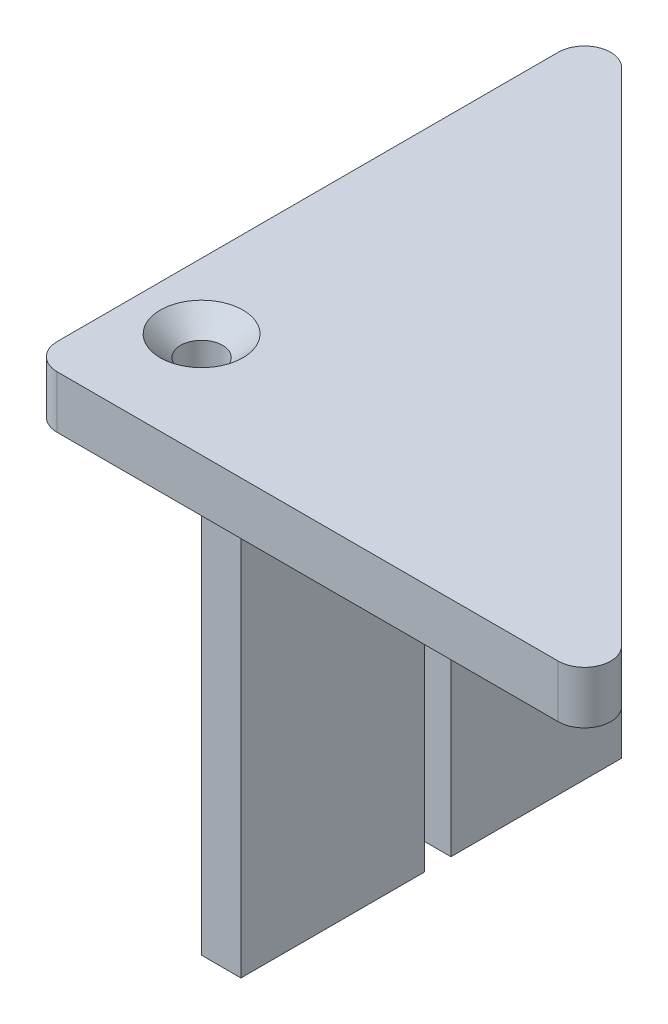
from build123d import *

# Parameters (mm, degrees)
SKETCH1_R                                           = 1.6
BOSS_EXTRUDE1_DEPTH                                 = 4
CSK_FOR_M3_COUNTERSUNK_FLAT_HEAD_SCREW1_D           = 3.2
CSK_FOR_M3_COUNTERSUNK_FLAT_HEAD_SCREW1_CSINK_D     = 6.3
CSK_FOR_M3_COUNTERSUNK_FLAT_HEAD_SCREW1_CSINK_ANGLE = 90
FILLET1_R                                           = 2
SKETCH5_W                                           = 3
SKETCH5_H                                           = 14
SKETCH5_H_2                                         = 13
BOSS_EXTRUDE2_DEPTH                                 = 32


with BuildPart() as part:
    # Sketch1 → Boss-Extrude1 (new body)
    with BuildSketch(Plane(origin=(0, 0, 0), x_dir=(1, 0, 0), z_dir=(0, 1, 0))):
        Polygon((-22.811288741, 22.811288741), (22.188711259, -22.188711259), (-22.811288741, -22.188711259), align=None)
        with Locations((-17.811288741, -14.188711259)):
            Circle(SKETCH1_R, mode=Mode.SUBTRACT)
    extrude(amount=BOSS_EXTRUDE1_DEPTH)

    # CSK for M3 Countersunk Flat Head Screw1 (through all)
    with Locations(Plane(origin=(0, 4, 0), x_dir=(1, 0, 0), z_dir=(0, 1, 0))):
        with Locations((-17.811288741, -14.188711259)):
            CounterSinkHole(CSK_FOR_M3_COUNTERSUNK_FLAT_HEAD_SCREW1_D / 2, CSK_FOR_M3_COUNTERSUNK_FLAT_HEAD_SCREW1_CSINK_D / 2, counter_sink_angle=CSK_FOR_M3_COUNTERSUNK_FLAT_HEAD_SCREW1_CSINK_ANGLE)

    # Fillet1
    fillet1_edges = [part.edges().sort_by_distance(p)[0] for p in [
        (-22.811288741, 2, 22.188711259),
        (22.188711259, 2, 22.188711259),
        (-22.811288741, 2, -22.811288741),
    ]]
    fillet(fillet1_edges, radius=FILLET1_R)

    # Sketch5 → Boss-Extrude2 (add)
    with BuildSketch(Plane.XZ):
        with Locations((-11.311288741, 12.188711259)):
            Rectangle(SKETCH5_W, SKETCH5_H)
        with Locations((-11.311288741, -3.311288741)):
            Rectangle(SKETCH5_W, SKETCH5_H_2)
    extrude(amount=BOSS_EXTRUDE2_DEPTH)


solid = part.part
